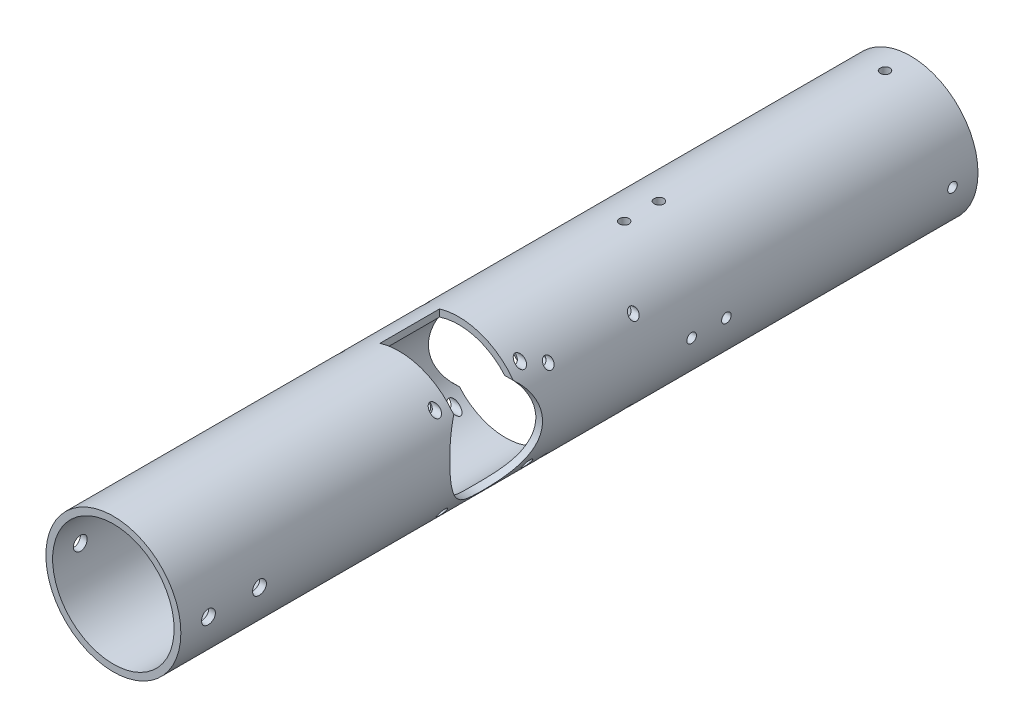
from build123d import *

# Parameters (mm, degrees)
BOSS_EXTRUDE1_DEPTH           = 125
BOSS_EXTRUDE1_DEPTH_BACK      = 250
SKETCH1_R                     = 31.75
SKETCH1_R_2                   = 28.575
SKETCH2_R                     = 21.75
CUT_EXTRUDE1_DEPTH            = 255.000246063
SKETCH3_R                     = 21.75
CUT_EXTRUDE2_DEPTH            = 255.000246187
CUT_EXTRUDE4_START            = 9
SKETCH5_W                     = 28
SKETCH5_H                     = 22
CUT_EXTRUDE4_DEPTH            = 264.000246187
CUT_EXTRUDE5_START            = -9
SKETCH6_W                     = 28
SKETCH6_H                     = 22
CUT_EXTRUDE5_DEPTH            = 264.000246187
CUT_EXTRUDE8_DEPTH            = 255.000246187
CUT_EXTRUDE8_DEPTH_BACK       = 255.000246187
SKETCH11_R                    = 2
CUT_EXTRUDE10_DEPTH           = 255.000246187
CUT_EXTRUDE10_DEPTH_BACK      = 255.000246187
SKETCH12_R                    = 3.25
SKETCH13_R                    = 2.25
CUT_EXTRUDE11_DEPTH           = 255.000246187
CUT_EXTRUDE12_DEPTH           = 255.00024619
CUT_EXTRUDE12_DEPTH_BACK      = 255.00024619
SKETCH15_R                    = 2
SKETCH19_W                    = 2.25
SKETCH19_H                    = 31.75
M4_CLEARANCE_HOLE1_AT_2_COUNT = 2
M4_CLEARANCE_HOLE1_AT_2_PITCH = 40
M4_CLEARANCE_HOLE1_AT_3_COUNT = 2
M4_CLEARANCE_HOLE1_AT_3_PITCH = 40
M4_CLEARANCE_HOLE1_AT_4_COUNT = 2
M4_CLEARANCE_HOLE1_AT_4_PITCH = 56.568542495
M4_CLEARANCE_HOLE1_AT_5_COUNT = 2
M4_CLEARANCE_HOLE1_AT_5_PITCH = 90.126807577
M4_CLEARANCE_HOLE1_AT_6_COUNT = 2
M4_CLEARANCE_HOLE1_AT_6_PITCH = 50.197623888
M4_CLEARANCE_HOLE1_AT_7_COUNT = 2
M4_CLEARANCE_HOLE1_AT_7_PITCH = 100.213978286
M4_CLEARANCE_HOLE1_AT_8_COUNT = 2
M4_CLEARANCE_HOLE1_AT_8_PITCH = 66.631835064
MIRROR1_COPY_1_SKETCH_W       = 2.25
MIRROR1_COPY_1_SKETCH_H       = 31.75
MIRROR1_COPY_2_SKETCH_W       = 2.25
MIRROR1_COPY_2_SKETCH_H       = 31.75
MIRROR1_COPY_3_SKETCH_W       = 2.25
MIRROR1_COPY_3_SKETCH_H       = 31.75
MIRROR1_COPY_4_SKETCH_W       = 2.25
MIRROR1_COPY_4_SKETCH_H       = 31.75
MIRROR1_COPY_5_SKETCH_W       = 2.25
MIRROR1_COPY_5_SKETCH_H       = 31.75
MIRROR1_COPY_6_SKETCH_W       = 2.25
MIRROR1_COPY_6_SKETCH_H       = 31.75
MIRROR1_COPY_7_SKETCH_W       = 2.25
MIRROR1_COPY_7_SKETCH_H       = 31.75
SKETCH21_R                    = 30
CUT_EXTRUDE14_DEPTH           = 7
CIRPATTERN1_COUNT             = 2
CIRPATTERN1_ANGLE             = 90
SKETCH22_R                    = 2.25
CUT_EXTRUDE15_DEPTH           = 255.00024619
CIRPATTERN2_COUNT             = 4


with BuildPart() as part:
    # Sketch1 → Boss-Extrude1 (new, two sides: drawn at the far end of the back side and taken through both)
    with BuildSketch(Plane.XY.offset(-BOSS_EXTRUDE1_DEPTH_BACK)):
        Circle(SKETCH1_R)
        Circle(SKETCH1_R_2, mode=Mode.SUBTRACT)
    extrude(amount=BOSS_EXTRUDE1_DEPTH + BOSS_EXTRUDE1_DEPTH_BACK)

    # Sketch2 → Cut-Extrude1 (cut, through all)
    with BuildSketch(Plane(origin=(0, 0, 0), x_dir=(0, 0, -1), z_dir=(1, 0, 0))):
        with Locations((73.488, -2)):
            Circle(SKETCH2_R)
    extrude(amount=-CUT_EXTRUDE1_DEPTH, mode=Mode.SUBTRACT)

    # Sketch3 → Cut-Extrude2 (cut, through all)
    with BuildSketch(Plane(origin=(0, 0, 0), x_dir=(0, 0, -1), z_dir=(1, 0, 0))):
        with Locations((23.45, 2)):
            Circle(SKETCH3_R)
    extrude(amount=CUT_EXTRUDE2_DEPTH, mode=Mode.SUBTRACT)

    # Sketch5 → Cut-Extrude4 (cut, through all)
    with BuildSketch(Plane(origin=(0, 0, 0), x_dir=(0, 0, -1), z_dir=(1, 0, 0)).offset(CUT_EXTRUDE4_START)):
        with Locations((73.488, -23.75)):
            Rectangle(SKETCH5_W, SKETCH5_H)
    extrude(amount=-CUT_EXTRUDE4_DEPTH, mode=Mode.SUBTRACT)

    # Sketch6 → Cut-Extrude5 (cut, through all)
    with BuildSketch(Plane(origin=(0, 0, 0), x_dir=(0, 0, -1), z_dir=(1, 0, 0)).offset(CUT_EXTRUDE5_START)):
        with Locations((23.45, 23.75)):
            Rectangle(SKETCH6_W, SKETCH6_H)
    extrude(amount=CUT_EXTRUDE5_DEPTH, mode=Mode.SUBTRACT)

    # Sketch11 → Cut-Extrude8 (cut, two sides: drawn at the far end of the back side and taken through both)
    with BuildSketch(Plane(origin=(0, 0, 0), x_dir=(0, 0, -1), z_dir=(1, 0, 0)).offset(-CUT_EXTRUDE8_DEPTH_BACK)):
        with Locations((93.488, 18)):
            Circle(SKETCH11_R)
        with Locations((53.488, 18)):
            Circle(SKETCH11_R)
        with Locations((53.488, -22)):
            Circle(SKETCH11_R)
        with Locations((93.488, -22)):
            Circle(SKETCH11_R)
    extrude(amount=CUT_EXTRUDE8_DEPTH + CUT_EXTRUDE8_DEPTH_BACK, mode=Mode.SUBTRACT)

    # Sketch12 → Cut-Extrude10 (cut, two sides: drawn at the far end of the back side and taken through both)
    with BuildSketch(Plane(origin=(0, 0, 0), x_dir=(0, 0, -1), z_dir=(1, 0, 0)).offset(-CUT_EXTRUDE10_DEPTH_BACK)):
        with Locations((-112, 0)):
            Circle(SKETCH12_R)
        with Locations((-88, 0)):
            Circle(SKETCH12_R)
    extrude(amount=CUT_EXTRUDE10_DEPTH + CUT_EXTRUDE10_DEPTH_BACK, mode=Mode.SUBTRACT)

    # Sketch13 → Cut-Extrude11 (cut, symmetric)
    with BuildSketch(Plane(origin=(0, 0, 0), x_dir=(1, 0, 0), z_dir=(0, 1, 0))):
        with Locations((0, 238)):
            Circle(SKETCH13_R)
    cut_extrude11 = extrude(amount=CUT_EXTRUDE11_DEPTH, both=True, mode=Mode.SUBTRACT)

    # Sketch15 → Cut-Extrude12 (cut, two sides: drawn at the far end of the back side and taken through both)
    with BuildSketch(Plane(origin=(0, 0, 0), x_dir=(0, 0, -1), z_dir=(1, 0, 0)).offset(-CUT_EXTRUDE12_DEPTH_BACK)):
        with Locations((3.45, 22)):
            Circle(SKETCH15_R)
        with Locations((43.45, 22)):
            Circle(SKETCH15_R)
        with Locations((43.45, -18)):
            Circle(SKETCH15_R)
        with Locations((3.45, -18)):
            Circle(SKETCH15_R)
    extrude(amount=CUT_EXTRUDE12_DEPTH + CUT_EXTRUDE12_DEPTH_BACK, mode=Mode.SUBTRACT)

    # Sketch19 → M4 Clearance Hole1 (revolve, cut)
    with BuildSketch(Plane(origin=(0, 22, -3.45), x_dir=(0, 0, 1), z_dir=(0, 1, 0))):
        with Locations((1.125, 15.875)):
            Rectangle(SKETCH19_W, SKETCH19_H)
    m4_clearance_hole1 = revolve(axis=Axis((-6.35, 22, -3.45), (1, 0, 0)), mode=Mode.SUBTRACT)

    # M4 Clearance Hole1 at 2: M4 Clearance Hole1 ×2
    with Locations(*[(0, 0, -i * M4_CLEARANCE_HOLE1_AT_2_PITCH) for i in range(1, M4_CLEARANCE_HOLE1_AT_2_COUNT)]):
        add(m4_clearance_hole1, mode=Mode.SUBTRACT)

    # M4 Clearance Hole1 at 3: M4 Clearance Hole1 ×2
    with Locations(*[(0, -i * M4_CLEARANCE_HOLE1_AT_3_PITCH, 0) for i in range(1, M4_CLEARANCE_HOLE1_AT_3_COUNT)]):
        add(m4_clearance_hole1, mode=Mode.SUBTRACT)

    # M4 Clearance Hole1 at 4: M4 Clearance Hole1 ×2
    with Locations(*[Vector(0, -0.7071067811865478, -0.7071067811865472) * (i * M4_CLEARANCE_HOLE1_AT_4_PITCH) for i in range(1, M4_CLEARANCE_HOLE1_AT_4_COUNT)]):
        add(m4_clearance_hole1, mode=Mode.SUBTRACT)

    # M4 Clearance Hole1 at 5: M4 Clearance Hole1 ×2
    with Locations(*[Vector(0, -0.04438191152602306, -0.9990146374950151) * (i * M4_CLEARANCE_HOLE1_AT_5_PITCH) for i in range(1, M4_CLEARANCE_HOLE1_AT_5_COUNT)]):
        add(m4_clearance_hole1, mode=Mode.SUBTRACT)

    # M4 Clearance Hole1 at 6: M4 Clearance Hole1 ×2
    with Locations(*[Vector(0, -0.07968504662542611, -0.9968200907607669) * (i * M4_CLEARANCE_HOLE1_AT_6_PITCH) for i in range(1, M4_CLEARANCE_HOLE1_AT_6_COUNT)]):
        add(m4_clearance_hole1, mode=Mode.SUBTRACT)

    # M4 Clearance Hole1 at 7: M4 Clearance Hole1 ×2
    with Locations(*[Vector(0, -0.43906050585303297, -0.8984574960453493) * (i * M4_CLEARANCE_HOLE1_AT_7_PITCH) for i in range(1, M4_CLEARANCE_HOLE1_AT_7_COUNT)]):
        add(m4_clearance_hole1, mode=Mode.SUBTRACT)

    # M4 Clearance Hole1 at 8: M4 Clearance Hole1 ×2
    with Locations(*[Vector(0, -0.6603450131265124, -0.7509623583369185) * (i * M4_CLEARANCE_HOLE1_AT_8_PITCH) for i in range(1, M4_CLEARANCE_HOLE1_AT_8_COUNT)]):
        add(m4_clearance_hole1, mode=Mode.SUBTRACT)

    # Mirror1: M4 Clearance Hole1 across plane
    add(m4_clearance_hole1.mirror(Plane(origin=(0, 0, 0), x_dir=(0, 0, 1), z_dir=(1, 0, 0))), mode=Mode.SUBTRACT)

    # Mirror1 copy 1 sketch → Mirror1 copy 1 (revolve, cut)
    with BuildSketch(Plane(origin=(0, 22, -43.45), x_dir=(0, 0, 1), z_dir=(0, 1, 0))):
        with Locations((1.125, -15.875)):
            Rectangle(MIRROR1_COPY_1_SKETCH_W, MIRROR1_COPY_1_SKETCH_H)
    revolve(axis=Axis((6.35, 22, -43.45), (1, 0, 0)), mode=Mode.SUBTRACT)

    # Mirror1 copy 2 sketch → Mirror1 copy 2 (revolve, cut)
    with BuildSketch(Plane(origin=(0, -18, -3.45), x_dir=(0, 0, 1), z_dir=(0, 1, 0))):
        with Locations((1.125, -15.875)):
            Rectangle(MIRROR1_COPY_2_SKETCH_W, MIRROR1_COPY_2_SKETCH_H)
    revolve(axis=Axis((6.35, -18, -3.45), (1, 0, 0)), mode=Mode.SUBTRACT)

    # Mirror1 copy 3 sketch → Mirror1 copy 3 (revolve, cut)
    with BuildSketch(Plane(origin=(0, -18, -43.45), x_dir=(0, 0, 1), z_dir=(0, 1, 0))):
        with Locations((1.125, -15.875)):
            Rectangle(MIRROR1_COPY_3_SKETCH_W, MIRROR1_COPY_3_SKETCH_H)
    revolve(axis=Axis((6.35, -18, -43.45), (1, 0, 0)), mode=Mode.SUBTRACT)

    # Mirror1 copy 4 sketch → Mirror1 copy 4 (revolve, cut)
    with BuildSketch(Plane(origin=(0, 18, -93.488), x_dir=(0, 0, 1), z_dir=(0, 1, 0))):
        with Locations((1.125, -15.875)):
            Rectangle(MIRROR1_COPY_4_SKETCH_W, MIRROR1_COPY_4_SKETCH_H)
    revolve(axis=Axis((6.35, 18, -93.488), (1, 0, 0)), mode=Mode.SUBTRACT)

    # Mirror1 copy 5 sketch → Mirror1 copy 5 (revolve, cut)
    with BuildSketch(Plane(origin=(0, 18, -53.488), x_dir=(0, 0, 1), z_dir=(0, 1, 0))):
        with Locations((1.125, -15.875)):
            Rectangle(MIRROR1_COPY_5_SKETCH_W, MIRROR1_COPY_5_SKETCH_H)
    revolve(axis=Axis((6.35, 18, -53.488), (1, 0, 0)), mode=Mode.SUBTRACT)

    # Mirror1 copy 6 sketch → Mirror1 copy 6 (revolve, cut)
    with BuildSketch(Plane(origin=(0, -22, -93.488), x_dir=(0, 0, 1), z_dir=(0, 1, 0))):
        with Locations((1.125, -15.875)):
            Rectangle(MIRROR1_COPY_6_SKETCH_W, MIRROR1_COPY_6_SKETCH_H)
    revolve(axis=Axis((6.35, -22, -93.488), (1, 0, 0)), mode=Mode.SUBTRACT)

    # Mirror1 copy 7 sketch → Mirror1 copy 7 (revolve, cut)
    with BuildSketch(Plane(origin=(0, -22, -53.488), x_dir=(0, 0, 1), z_dir=(0, 1, 0))):
        with Locations((1.125, -15.875)):
            Rectangle(MIRROR1_COPY_7_SKETCH_W, MIRROR1_COPY_7_SKETCH_H)
    revolve(axis=Axis((6.35, -22, -53.488), (1, 0, 0)), mode=Mode.SUBTRACT)

    # Sketch21 → Cut-Extrude14 (cut)
    with BuildSketch(Plane(origin=(0, 0, -250), x_dir=(-1, 0, 0), z_dir=(0, 0, -1))):
        Circle(SKETCH21_R)
    extrude(amount=-CUT_EXTRUDE14_DEPTH, mode=Mode.SUBTRACT)

    # CirPattern1: Cut-Extrude11 ×2 about axis
    cirpattern1_axis = Axis((0, 0, -250), (0, 0, 1))
    for i in range(1, CIRPATTERN1_COUNT):
        add(cut_extrude11.rotate(cirpattern1_axis, i * CIRPATTERN1_ANGLE / (CIRPATTERN1_COUNT - 1)), mode=Mode.SUBTRACT)

    # Sketch22 → Cut-Extrude15 (cut, through all)
    with BuildSketch(Plane(origin=(0, 0, 0), x_dir=(0, 0, -1), z_dir=(1, 0, 0))):
        with Locations((131.65, 0)):
            Circle(SKETCH22_R)
        with Locations((115.3, 0)):
            Circle(SKETCH22_R)
    cut_extrude15 = extrude(amount=CUT_EXTRUDE15_DEPTH, mode=Mode.SUBTRACT)

    # CirPattern2: Cut-Extrude15 ×4 about axis
    cirpattern2_axis = Axis((0, 0, -250), (0, 0, 1))
    for i in range(1, CIRPATTERN2_COUNT):
        add(cut_extrude15.rotate(cirpattern2_axis, i * 360 / CIRPATTERN2_COUNT), mode=Mode.SUBTRACT)


solid = part.part
